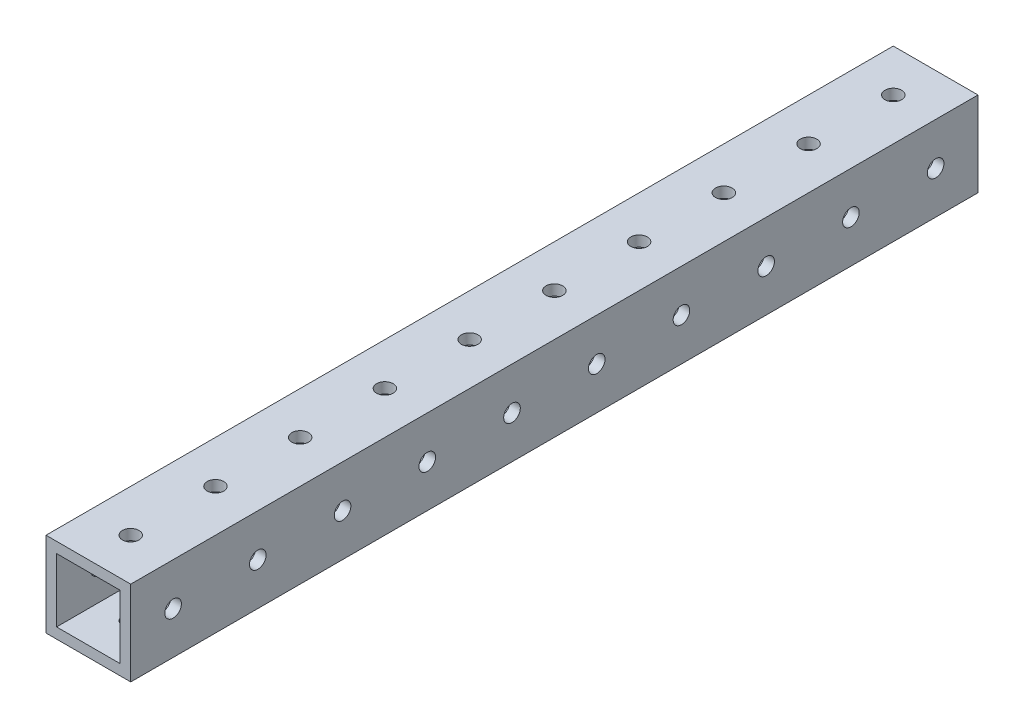
from build123d import *

# Parameters (mm, degrees)
SKETCH1_W           = 25.4
SKETCH1_H           = 25.4
BOSS_EXTRUDE1_DEPTH = 127
SHELL1_T            = -3.175
SKETCH2_R           = 2.4892
CUT_EXTRUDE1_DEPTH  = 131.136274728
SKETCH3_R           = 2.4892
CUT_EXTRUDE2_DEPTH  = 131.136274728


with BuildPart() as part:
    # Sketch1 → Boss-Extrude1 (new, symmetric)
    with BuildSketch(Plane.XY):
        Rectangle(SKETCH1_W, SKETCH1_H)
    extrude(amount=BOSS_EXTRUDE1_DEPTH, both=True)

    # Shell1
    shell1_openings = [part.faces().sort_by_distance(p)[0] for p in [
        (0, 0, -127),
        (0, 0, 127),
    ]]
    offset(amount=SHELL1_T, openings=shell1_openings, kind=Kind.INTERSECTION)

    # Sketch2 → Cut-Extrude1 (cut, through all)
    with BuildSketch(Plane(origin=(0, 12.7, 0), x_dir=(1, 0, 0), z_dir=(0, 1, 0))):
        with Locations((0, -114.3)):
            Circle(SKETCH2_R)
        with Locations((0, -88.9)):
            Circle(SKETCH2_R)
        with Locations((0, -63.5)):
            Circle(SKETCH2_R)
        with Locations((0, -38.1)):
            Circle(SKETCH2_R)
        with Locations((0, -12.7)):
            Circle(SKETCH2_R)
        with Locations((0, 12.7)):
            Circle(SKETCH2_R)
        with Locations((0, 38.1)):
            Circle(SKETCH2_R)
        with Locations((0, 63.5)):
            Circle(SKETCH2_R)
        with Locations((0, 88.9)):
            Circle(SKETCH2_R)
        with Locations((0, 114.3)):
            Circle(SKETCH2_R)
    extrude(amount=-CUT_EXTRUDE1_DEPTH, mode=Mode.SUBTRACT)

    # Sketch3 → Cut-Extrude2 (cut, through all)
    with BuildSketch(Plane.ZY.offset(12.7)):
        with Locations((114.3, 0)):
            Circle(SKETCH3_R)
        with Locations((88.9, 0)):
            Circle(SKETCH3_R)
        with Locations((63.5, 0)):
            Circle(SKETCH3_R)
        with Locations((38.1, 0)):
            Circle(SKETCH3_R)
        with Locations((12.7, 0)):
            Circle(SKETCH3_R)
        with Locations((-12.7, 0)):
            Circle(SKETCH3_R)
        with Locations((-38.1, 0)):
            Circle(SKETCH3_R)
        with Locations((-63.5, 0)):
            Circle(SKETCH3_R)
        with Locations((-88.9, 0)):
            Circle(SKETCH3_R)
        with Locations((-114.3, 0)):
            Circle(SKETCH3_R)
    extrude(amount=-CUT_EXTRUDE2_DEPTH, mode=Mode.SUBTRACT)


solid = part.part
